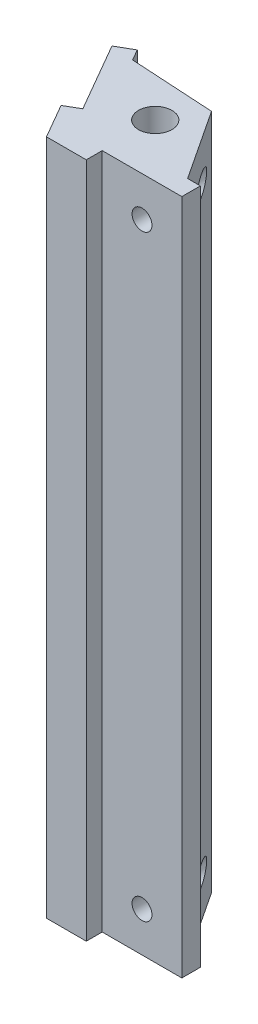
from build123d import *

# Parameters (mm, degrees)
BOSS_EXTRUDE1_DEPTH       = 85
SKETCH3_W                 = 10
SKETCH3_H                 = 2
CUT_EXTRUDE1_DEPTH        = 88.633826232
M5X0_8_TAPPED_HOLE1_D     = 4.2
M5X0_8_TAPPED_HOLE1_DEPTH = 16
M5X0_8_TAPPED_HOLE1_TIP   = 1.2618073
M5X0_8_TAPPED_HOLE2_D     = 4.2
M5X0_8_TAPPED_HOLE2_DEPTH = 16.4
M5X0_8_TAPPED_HOLE2_TIP   = 1.2618073
M3X0_5_TAPPED_HOLE1_D     = 2.5
M3X0_5_TAPPED_HOLE2_D     = 2.5


with BuildPart() as part:
    # Sketch1 → Boss-Extrude1 (new body)
    with BuildSketch(Plane(origin=(0, 0, 0), x_dir=(1, 0, 0), z_dir=(0, 1, 0))):
        Polygon((0, 0), (15, 0), (15, 4.330127019), (13.397927821, 4.330127019), (7.58741124, 13.141781765), (-2.948963911, 13.768009361), (-3.75, 15.155444566), (-7.5, 12.990381057), align=None)
    extrude(amount=BOSS_EXTRUDE1_DEPTH)

    # Sketch3 → Cut-Extrude1 (cut, through all)
    with BuildSketch(Plane(origin=(0, 85, 0), x_dir=(1, 0, 0), z_dir=(0, 1, 0))):
        Polygon((-7.5, 12.990381057), (-5.767949192, 13.990381057), (-0.767949192, 5.330127019), (-2.5, 4.330127019), align=None)
        with Locations((10, 1)):
            Rectangle(SKETCH3_W, SKETCH3_H)
    extrude(amount=-CUT_EXTRUDE1_DEPTH, mode=Mode.SUBTRACT)

    # M5x0.8 Tapped Hole1
    with Locations(Plane(origin=(0, 85, 0), x_dir=(1, 0, 0), z_dir=(0, 1, 0))):
        with Locations((5, 8.660254038)):
            Hole(M5X0_8_TAPPED_HOLE1_D / 2, depth=M5X0_8_TAPPED_HOLE1_DEPTH)
            with Locations((0, 0, -(M5X0_8_TAPPED_HOLE1_DEPTH + M5X0_8_TAPPED_HOLE1_TIP / 2))):  # 118° drill point
                Cone(0, M5X0_8_TAPPED_HOLE1_D / 2, M5X0_8_TAPPED_HOLE1_TIP, mode=Mode.SUBTRACT)

    # M5x0.8 Tapped Hole2
    with Locations(Plane(origin=(0, 0, 0), x_dir=(-1, 0, 0), z_dir=(0, -1, 0))):
        with Locations((-5, 8.660254038)):
            Hole(M5X0_8_TAPPED_HOLE2_D / 2, depth=M5X0_8_TAPPED_HOLE2_DEPTH)
            with Locations((0, 0, -(M5X0_8_TAPPED_HOLE2_DEPTH + M5X0_8_TAPPED_HOLE2_TIP / 2))):  # 118° drill point
                Cone(0, M5X0_8_TAPPED_HOLE2_D / 2, M5X0_8_TAPPED_HOLE2_TIP, mode=Mode.SUBTRACT)

    # M3x0.5 Tapped Hole1 (through all)
    with Locations(Plane(origin=(1.732050808, 0, -1), x_dir=(0.49999999999999983, 0, 0.8660254037844387), z_dir=(-0.8660254037844387, 0, 0.49999999999999983))):
        with Locations((-10, 80), (-10, 5)):
            Hole(M3X0_5_TAPPED_HOLE1_D / 2)

    # M3x0.5 Tapped Hole2 (through all)
    with Locations(Plane.XY.offset(-2)):
        with Locations((10, 80), (10, 5)):
            Hole(M3X0_5_TAPPED_HOLE2_D / 2)


solid = part.part
